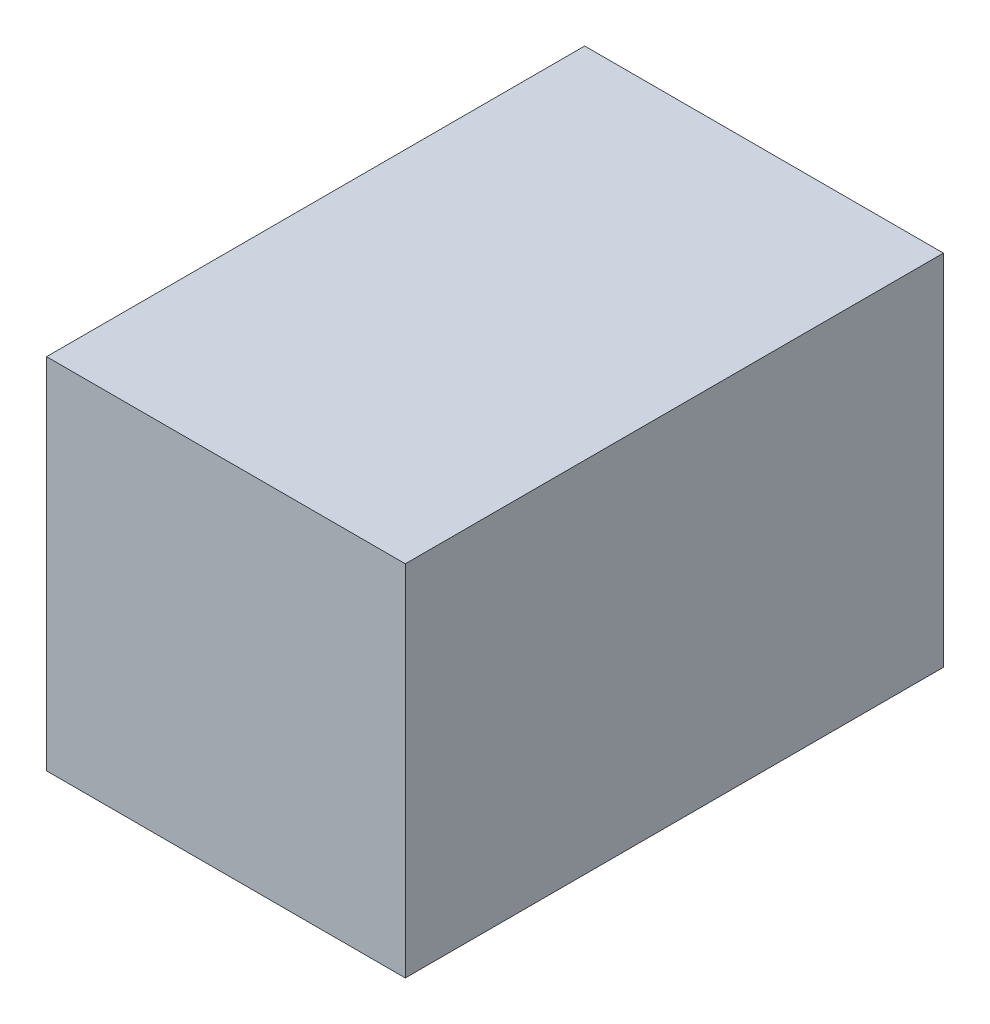
from build123d import *

# Parameters (mm, degrees)
SKETCH1_W           = 20
SKETCH1_H           = 20
BOSS_EXTRUDE1_DEPTH = 30


with BuildPart() as part:
    # Sketch1 → Boss-Extrude1 (new body)
    with BuildSketch(Plane.XY):
        with Locations((-10, 10)):
            Rectangle(SKETCH1_W, SKETCH1_H)
    extrude(amount=BOSS_EXTRUDE1_DEPTH)


solid = part.part
